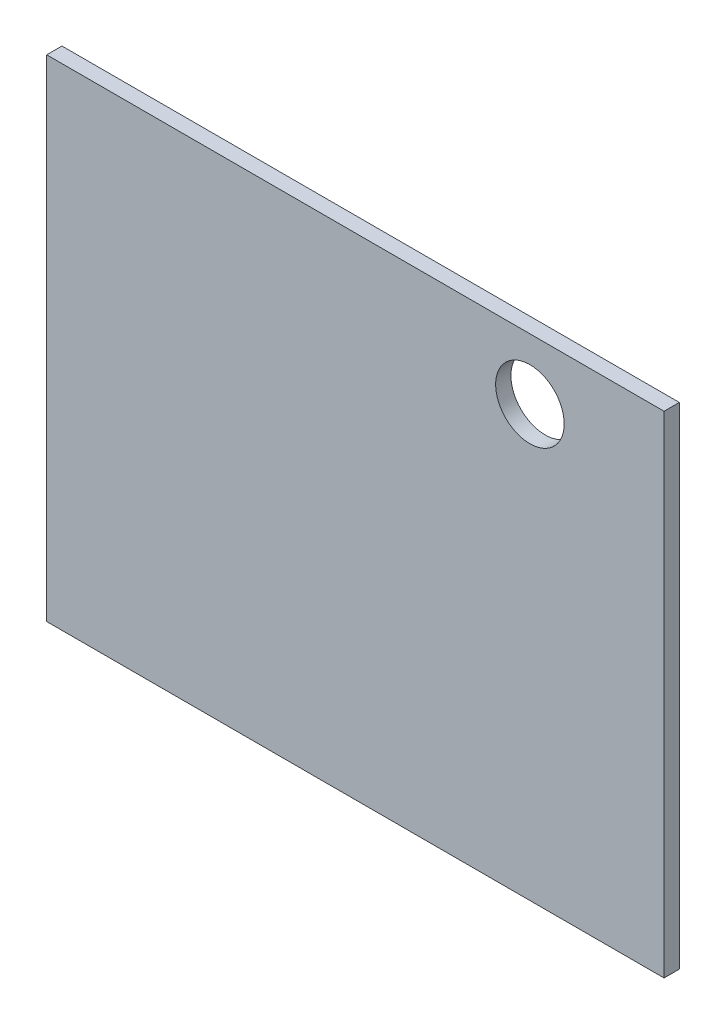
from build123d import *

# Parameters (mm, degrees)
SKETCH1_W           = 257.175
SKETCH1_H           = 204.47
BOSS_EXTRUDE1_DEPTH = 6.35
SKETCH2_R           = 14.2748
CUT_EXTRUDE1_DEPTH  = 165.399096352


with BuildPart() as part:
    # Sketch1 → Boss-Extrude1 (new body)
    with BuildSketch(Plane.XY):
        Rectangle(SKETCH1_W, SKETCH1_H)
    extrude(amount=BOSS_EXTRUDE1_DEPTH)

    # Sketch2 → Cut-Extrude1 (cut, through all)
    with BuildSketch(Plane.XY.offset(6.35)):
        with Locations((72.7075, 76.835)):
            Circle(SKETCH2_R)
    extrude(amount=-CUT_EXTRUDE1_DEPTH, mode=Mode.SUBTRACT)


solid = part.part
